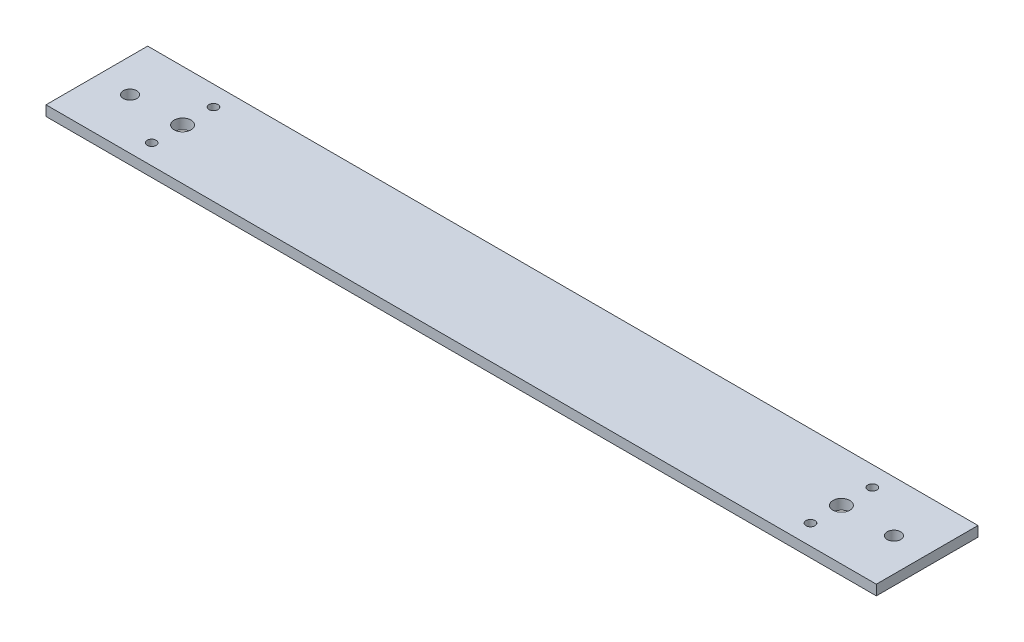
from build123d import *

# Parameters (mm, degrees)
SKETCH2_W                  = 490
SKETCH2_H                  = 60
BOSS_EXTRUDE1_DEPTH        = 6
F_10_0_10_DIAMETER_HOLE1_D = 10
M5_CLEARANCE_HOLE1_D       = 5.3
F_8_0_8_DIAMETER_HOLE1_D   = 8


with BuildPart() as part:
    # Sketch2 → Boss-Extrude1 (new body)
    with BuildSketch(Plane(origin=(0, 0, 0), x_dir=(1, 0, 0), z_dir=(0, 1, 0))):
        Rectangle(SKETCH2_W, SKETCH2_H)
    extrude(amount=BOSS_EXTRUDE1_DEPTH)

    # Ø10.0 (10) Diameter Hole1 (through all)
    with Locations(Plane(origin=(0, 6, 0), x_dir=(1, 0, 0), z_dir=(0, 1, 0))):
        with Locations((194.4, 0)):
            f_10_0_10_diameter_hole1 = Hole(F_10_0_10_DIAMETER_HOLE1_D / 2)

    # M5 Clearance Hole1 (through all)
    with Locations(Plane(origin=(0, 6, 0), x_dir=(1, 0, 0), z_dir=(0, 1, 0))):
        with Locations((194.4, -18.25), (194.4, 18.25)):
            m5_clearance_hole1 = Hole(M5_CLEARANCE_HOLE1_D / 2)

    # Ø8.0 (8) Diameter Hole1 (through all)
    with Locations(Plane(origin=(0, 6, 0), x_dir=(1, 0, 0), z_dir=(0, 1, 0))):
        with Locations((225.4, 0)):
            f_8_0_8_diameter_hole1 = Hole(F_8_0_8_DIAMETER_HOLE1_D / 2)

    # Mirror1: Ø10.0 (10) Diameter Hole1, M5 Clearance Hole1, Ø8.0 (8) Diameter Hole1 across plane
    add(f_10_0_10_diameter_hole1.mirror(Plane(origin=(0, 0, 0), x_dir=(0, 0, 1), z_dir=(1, 0, 0))), mode=Mode.SUBTRACT)
    add(m5_clearance_hole1.mirror(Plane(origin=(0, 0, 0), x_dir=(0, 0, 1), z_dir=(1, 0, 0))), mode=Mode.SUBTRACT)
    add(f_8_0_8_diameter_hole1.mirror(Plane(origin=(0, 0, 0), x_dir=(0, 0, 1), z_dir=(1, 0, 0))), mode=Mode.SUBTRACT)


solid = part.part
